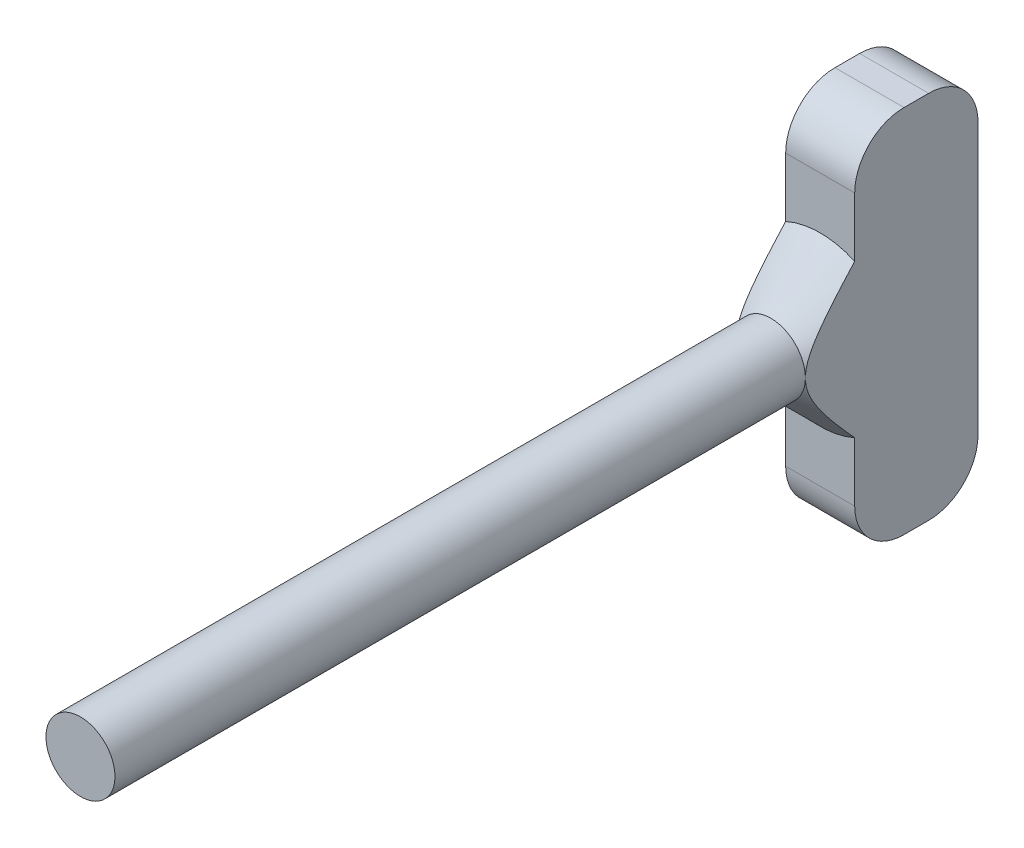
from build123d import *

# Parameters (mm, degrees)
SKETCH1_R           = 1.778
BOSS_EXTRUDE1_DEPTH = 38.1
SKETCH2_W           = 3.556
SKETCH2_H           = 19.05
BOSS_EXTRUDE2_DEPTH = 6.35
FILLET2_R           = 2.54
CHAMFER2_SIZE       = 2.54
BOSS_EXTRUDE3_DEPTH = 0.254


with BuildPart() as part:
    # Sketch1 → Boss-Extrude1 (new body)
    with BuildSketch(Plane.XY):
        with Locations(Location((0, 0, 0), (0, 0, 180))):
            Circle(SKETCH1_R)
    extrude(amount=BOSS_EXTRUDE1_DEPTH)

    # Sketch2 → Boss-Extrude2 (add)
    with BuildSketch(Plane(origin=(0, 0, 0), x_dir=(-1, 0, 0), z_dir=(0, 0, -1))):
        Rectangle(SKETCH2_W, SKETCH2_H)
    extrude(amount=BOSS_EXTRUDE2_DEPTH)

    # Fillet2
    fillet2_edges = [part.edges().sort_by_distance(p)[0] for p in [
        (0, 9.525, 0),
        (0, -9.525, 0),
        (0, 9.525, -6.35),
        (0, -9.525, -6.35),
    ]]
    fillet(fillet2_edges, radius=FILLET2_R)

    # Chamfer2
    # the kernel refuses this chamfer: 2.54 mm, written as the material it adds along each edge
    with BuildSketch(Plane(origin=(0, 0, 0), x_dir=(1, 0, 0), z_dir=(0, -1, 0))) as chamfer2_piece_1_section:
        Polygon((1.778, CHAMFER2_SIZE), (1.778 + CHAMFER2_SIZE, 0), (1.778, 0), align=None)
    chamfer2_piece_1 = revolve(axis=Axis((0, 0, 0), (0, 0, 1)), revolution_arc=180, mode=Mode.PRIVATE)
    chamfer2_piece_1 = split(chamfer2_piece_1, bisect_by=Plane(origin=(1.778, 2.298767146, 0.868261235), z_dir=(-1, 0, 0)), keep=Keep.TOP, mode=Mode.PRIVATE)
    chamfer2_piece_1 = split(chamfer2_piece_1, bisect_by=Plane(origin=(-1.778, 2.298767146, 0.868261235), z_dir=(1, 0, 0)), keep=Keep.TOP, mode=Mode.PRIVATE)
    add(chamfer2_piece_1)
    with BuildSketch(Plane(origin=(0, 0, 0), x_dir=(-1, 0, 0), z_dir=(0, 1, 0))) as chamfer2_piece_2_section:
        Polygon((1.778 + CHAMFER2_SIZE, 0), (1.778, CHAMFER2_SIZE), (1.778, 0), align=None)
    chamfer2_piece_2 = revolve(axis=Axis((0, 0, 0), (0, 0, 1)), revolution_arc=180, mode=Mode.PRIVATE)
    chamfer2_piece_2 = split(chamfer2_piece_2, bisect_by=Plane(origin=(1.778, -2.298767146, 0.868261235), z_dir=(-1, 0, 0)), keep=Keep.TOP, mode=Mode.PRIVATE)
    chamfer2_piece_2 = split(chamfer2_piece_2, bisect_by=Plane(origin=(-1.778, -2.298767146, 0.868261235), z_dir=(1, 0, 0)), keep=Keep.TOP, mode=Mode.PRIVATE)
    add(chamfer2_piece_2)

    # Sketch3 → Boss-Extrude3 (add)
    # profile 1 of 7: a face of its own
    with BuildSketch(Plane.ZY.offset(1.778)):
        with BuildLine():
            Line((-4.28625, 5.937860577), (-4.28625, 6.1515625))
            Line((-4.28625, 6.1515625), (-2.859503456, 6.1515625))
            add(Edge.make_bspline(
                [(-2.859503456, 6.1515625), (-2.839309955, 6.151530697), (-2.800989308, 6.151470346), (-2.746446232, 6.151873468), (-2.697955505, 6.153002431), (-2.655330213, 6.153714193), (-2.618765951, 6.155297611), (-2.588064624, 6.156588961), (-2.563371604, 6.158249411), (-2.54896101, 6.160244978), (-2.542766677, 6.161102764)],
                knots=[0, 0, 0, 0, 1.528628734, 2.90083645, 4.128790002, 5.200304208, 6.127813768, 6.898992206, 7.526736466, 8, 8, 8, 8], degree=3))
            add(Edge.make_bspline(
                [(-2.542766677, 6.161102764), (-2.520247803, 6.164585161), (-2.47677613, 6.171307771), (-2.414916243, 6.189168491), (-2.359062379, 6.212979709), (-2.307954675, 6.242518948), (-2.261917924, 6.279841904), (-2.220598789, 6.326179507), (-2.183050197, 6.380700986), (-2.150313224, 6.442625207), (-2.123122409, 6.508605574), (-2.1027767, 6.57627669), (-2.09032514, 6.644332505), (-2.088887153, 6.689901415), (-2.088173077, 6.712530048)],
                knots=[0, 0, 0, 0, 1.042777144, 2.01303441, 2.939567723, 3.817555404, 4.708046775, 5.641195415, 6.651191522, 7.732783915, 8.843021186, 9.914367358, 10.964315445, 12, 12, 12, 12], degree=3))
            add(Edge.make_bspline(
                [(-2.088173077, 6.712530048), (-2.088899629, 6.731958497), (-2.090348536, 6.770703182), (-2.099431362, 6.828240334), (-2.115478105, 6.884455311), (-2.137336698, 6.938906493), (-2.164216907, 6.990708957), (-2.196418961, 7.038534553), (-2.233928117, 7.081394052), (-2.275498615, 7.120505734), (-2.322343759, 7.154363828), (-2.373333404, 7.184299676), (-2.429827168, 7.208074244), (-2.469505718, 7.220111235), (-2.489818209, 7.226273287)],
                knots=[0, 0, 0, 0, 0.994718802, 1.98369237, 2.973235266, 3.981451368, 4.982709966, 5.955777334, 6.925228988, 7.892833478, 8.871333226, 9.877970804, 10.913677552, 12, 12, 12, 12], degree=3))
            add(Edge.make_bspline(
                [(-2.489818209, 7.226273287), (-2.49821965, 7.228314444), (-2.516941446, 7.232862964), (-2.548592538, 7.237113185), (-2.585936909, 7.241539946), (-2.629242874, 7.244611466), (-2.678365322, 7.247605868), (-2.733560151, 7.249397298), (-2.79462694, 7.250225315), (-2.83724258, 7.250472067), (-2.859503456, 7.250600962)],
                knots=[0, 0, 0, 0, 0.558680831, 1.244966039, 2.062412453, 2.990489873, 4.051219941, 5.244515665, 6.560634259, 8, 8, 8, 8], degree=3))
            Line((-2.859503456, 7.250600962), (-4.28625, 7.250600962))
            Line((-4.28625, 7.250600962), (-4.28625, 7.464302885))
            Line((-4.28625, 7.464302885), (-2.848055138, 7.464302885))
            add(Edge.make_bspline(
                [(-2.848055138, 7.464302885), (-2.822134639, 7.464129967), (-2.771549209, 7.463792509), (-2.697423302, 7.460866923), (-2.627106615, 7.456200506), (-2.560588255, 7.449613294), (-2.498111198, 7.440865316), (-2.439263921, 7.431227039), (-2.384370871, 7.418738211), (-2.332798724, 7.404258768), (-2.283458787, 7.387942414), (-2.23672446, 7.366438495), (-2.191223152, 7.342315957), (-2.147464355, 7.313937062), (-2.105726088, 7.281288378), (-2.064927907, 7.245620715), (-2.026285709, 7.20567689), (-1.989322903, 7.162636719), (-1.954947484, 7.116789584), (-1.925033077, 7.067839449), (-1.900674638, 7.016056565), (-1.879056044, 6.962667111), (-1.863690097, 6.906391045), (-1.852006666, 6.847929364), (-1.845423895, 6.786935303), (-1.844440357, 6.745458581), (-1.843942308, 6.724455379)],
                knots=[0, 0, 0, 0, 1.316707045, 2.569633854, 3.76780728, 4.896239288, 5.964314126, 6.972204208, 7.924543903, 8.822147865, 9.693191779, 10.560896119, 11.431827672, 12.307838457, 13.206132673, 14.12176355, 15.058527151, 16.026630406, 17.00238624, 17.966538933, 18.934743273, 19.906713913, 20.888635248, 21.892958714, 22.933025263, 24, 24, 24, 24], degree=3))
            add(Edge.make_bspline(
                [(-1.843942308, 6.724455379), (-1.844475858, 6.701548197), (-1.845522683, 6.656604388), (-1.851530544, 6.590382109), (-1.862817891, 6.526886493), (-1.877283175, 6.465497841), (-1.89690774, 6.406809235), (-1.921021095, 6.350837971), (-1.948550153, 6.296941382), (-1.981080076, 6.246333744), (-2.016551767, 6.198599908), (-2.055513531, 6.155220765), (-2.096481503, 6.115095132), (-2.140998334, 6.079991657), (-2.188152724, 6.048582611), (-2.238166461, 6.021560107), (-2.2909725, 5.998348721), (-2.327680236, 5.986370265), (-2.34623723, 5.980314754)],
                knots=[0, 0, 0, 0, 1.138939089, 2.234594419, 3.301501784, 4.342532435, 5.367382236, 6.373123747, 7.370098489, 8.372230273, 9.360297234, 10.323289009, 11.268038109, 12.20748145, 13.137029304, 14.081414587, 15.030090602, 16, 16, 16, 16], degree=3))
            add(Edge.make_bspline(
                [(-2.34623723, 5.980314754), (-2.358914035, 5.976792437), (-2.386410307, 5.969152454), (-2.431917008, 5.960970957), (-2.484314657, 5.954093171), (-2.543606842, 5.947625997), (-2.609839519, 5.943809902), (-2.682983978, 5.940464287), (-2.763128662, 5.937837007), (-2.818955038, 5.937852501), (-2.848055138, 5.937860577)],
                knots=[0, 0, 0, 0, 0.625038921, 1.35572334, 2.194682327, 3.136881307, 4.189498639, 5.346923369, 6.617055217, 8, 8, 8, 8], degree=3))
            Line((-2.848055138, 5.937860577), (-4.28625, 5.937860577))
        make_face()
    # profile 2 of 7: a face of its own
    with BuildSketch(Plane.ZY.offset(1.778)):
        Polygon((-4.28625, 4.350360577), (-4.28625, 5.510456731), (-4.042019231, 5.510456731), (-4.042019231, 4.5640625), (-3.309326923, 4.5640625), (-3.309326923, 5.510456731), (-3.065096154, 5.510456731), (-3.065096154, 4.5640625), (-1.905, 4.5640625), (-1.905, 4.350360577), align=None)
    # profile 3 of 7: a face of its own
    with BuildSketch(Plane.ZY.offset(1.778)):
        Polygon((-1.905, 1.205889423), (-4.28625, 1.520241136), (-4.28625, 1.550769982), (-2.332403846, 2.533894231), (-4.28625, 3.5141564), (-4.28625, 3.544685246), (-1.905, 3.861899038), (-1.905, 3.648197115), (-3.617000451, 3.419230769), (-1.905, 2.560129958), (-1.905, 2.511474609), (-3.622247596, 1.648557692), (-1.905, 1.421022386), align=None)
    # profile 4 of 7: a face of its own
    with BuildSketch(Plane.ZY.offset(1.778)):
        Polygon((-4.28625, -0.1984375), (-4.28625, 0.015264423), (-2.149230769, 0.015264423), (-2.149230769, 0.931129808), (-1.905, 0.931129808), (-1.905, -0.1984375), align=None)
    # profile 5 of 7: a face of its own
    with BuildSketch(Plane.ZY.offset(1.778)):
        with BuildLine():
            Line((-1.905, -2.640745192), (-4.28625, -2.640745192))
            Line((-4.28625, -2.640745192), (-4.28625, -2.159915865))
            add(Edge.make_bspline(
                [(-4.28625, -2.159915865), (-4.285948894, -2.118095), (-4.28536716, -2.037297306), (-4.281678678, -1.920539552), (-4.275153736, -1.812509885), (-4.265649469, -1.7135636), (-4.25397928, -1.623429062), (-4.239351326, -1.542358651), (-4.222078303, -1.469933176), (-4.207351666, -1.425390574), (-4.20038762, -1.404326923)],
                knots=[0, 0, 0, 0, 1.314313732, 2.53924729, 3.670748893, 4.714932338, 5.66265055, 6.526160246, 7.303039223, 8, 8, 8, 8], degree=3))
            add(Edge.make_bspline(
                [(-4.20038762, -1.404326923), (-4.189892499, -1.376773557), (-4.16914025, -1.322291643), (-4.129933948, -1.244762103), (-4.085693964, -1.171527989), (-4.035402211, -1.103173187), (-3.979715418, -1.039526188), (-3.919031408, -0.979864617), (-3.852002114, -0.925659431), (-3.779820616, -0.876066384), (-3.703411764, -0.831339749), (-3.622900694, -0.792465501), (-3.538701847, -0.760179624), (-3.451047865, -0.733378219), (-3.35974642, -0.712255524), (-3.264691087, -0.69784425), (-3.166257569, -0.688338986), (-3.099463871, -0.687383729), (-3.065573167, -0.686899038)],
                knots=[0, 0, 0, 0, 0.984741985, 1.947153288, 2.898543998, 3.841229145, 4.778974371, 5.722123648, 6.681464302, 7.655713756, 8.646344578, 9.637374342, 10.639946623, 11.656849581, 12.698333139, 13.76849723, 14.867749466, 16, 16, 16, 16], degree=3))
            add(Edge.make_bspline(
                [(-3.065573167, -0.686899038), (-3.036140075, -0.687326961), (-2.978139092, -0.688170228), (-2.892658407, -0.695742133), (-2.809713652, -0.706747825), (-2.729699723, -0.723786761), (-2.651915889, -0.744471556), (-2.577190059, -0.770980259), (-2.504840775, -0.801351404), (-2.435831526, -0.836752633), (-2.370493737, -0.875670152), (-2.308855034, -0.917174519), (-2.2522832, -0.962207021), (-2.199295797, -1.009434831), (-2.151308324, -1.059996842), (-2.107446034, -1.113277469), (-2.068443277, -1.169483774), (-2.033687161, -1.228963691), (-2.002605729, -1.292511589), (-1.976680085, -1.36212637), (-1.95422583, -1.437478284), (-1.93636347, -1.518997044), (-1.921957348, -1.606391897), (-1.912365697, -1.699905279), (-1.905860745, -1.799360461), (-1.905292486, -1.867654447), (-1.905, -1.902805739)],
                knots=[0, 0, 0, 0, 1.106010661, 2.179509527, 3.223302912, 4.248870533, 5.252098245, 6.246278179, 7.226402005, 8.199283979, 9.158616973, 10.083547221, 10.989831858, 11.874256832, 12.749262829, 13.607058236, 14.46581075, 15.317568432, 16.194266721, 17.121067875, 18.106207572, 19.147242834, 20.255495536, 21.43354536, 22.679031616, 24, 24, 24, 24], degree=3))
            Line((-1.905, -1.902805739), (-1.905, -2.640745192))
        make_face()
        with BuildLine():
            Line((-2.149230769, -2.427043269), (-2.149230769, -2.153714694))
            add(Edge.make_bspline(
                [(-2.149230769, -2.153714694), (-2.149399563, -2.114438784), (-2.149724216, -2.038896827), (-2.15257301, -1.930272368), (-2.157227971, -1.831022278), (-2.163742444, -1.741132466), (-2.172361626, -1.660653683), (-2.181971605, -1.589417739), (-2.193944156, -1.527658144), (-2.204796505, -1.490286509), (-2.209811448, -1.473016827)],
                knots=[0, 0, 0, 0, 1.375205317, 2.645023457, 3.804390687, 4.853969522, 5.800190428, 6.637939096, 7.370582563, 8, 8, 8, 8], degree=3))
            add(Edge.make_bspline(
                [(-2.209811448, -1.473016827), (-2.217466525, -1.451280528), (-2.232593837, -1.408327102), (-2.260187552, -1.346495539), (-2.292873241, -1.288830385), (-2.329206138, -1.234327398), (-2.37046604, -1.183757083), (-2.415761989, -1.136530063), (-2.465300931, -1.092704156), (-2.519002536, -1.052954401), (-2.576284477, -1.01695027), (-2.637248059, -0.986042235), (-2.701036228, -0.959125385), (-2.768165384, -0.937812114), (-2.838143506, -0.921007534), (-2.911333462, -0.909228463), (-2.987670487, -0.901915838), (-3.039638751, -0.901044032), (-3.06605018, -0.900600962)],
                knots=[0, 0, 0, 0, 0.998590647, 1.973329978, 2.929871262, 3.868367705, 4.809062953, 5.754642869, 6.701828697, 7.672172887, 8.647399344, 9.630604387, 10.631475358, 11.644913558, 12.679592956, 13.747988925, 14.855477812, 16, 16, 16, 16], degree=3))
            add(Edge.make_bspline(
                [(-3.06605018, -0.900600962), (-3.093899566, -0.90095018), (-3.148609931, -0.901636224), (-3.228885743, -0.910259281), (-3.306093114, -0.922860554), (-3.380237208, -0.941083026), (-3.451462676, -0.964304213), (-3.519375593, -0.993283782), (-3.584693191, -1.026394464), (-3.645907893, -1.065789413), (-3.703801598, -1.108934665), (-3.756838782, -1.156816758), (-3.805140261, -1.208674966), (-3.849458258, -1.263943676), (-3.888009794, -1.324180524), (-3.92249484, -1.387966517), (-3.951761009, -1.456237411), (-3.967326806, -1.503734977), (-3.97523738, -1.527873347)],
                knots=[0, 0, 0, 0, 1.122418816, 2.205001699, 3.251619955, 4.274784885, 5.280384055, 6.268708349, 7.249350384, 8.229342522, 9.199999885, 10.157847722, 11.105861043, 12.055065948, 13.010012805, 13.98527497, 14.976112212, 16, 16, 16, 16], degree=3))
            add(Edge.make_bspline(
                [(-3.97523738, -1.527873347), (-3.980759449, -1.547842609), (-3.992500885, -1.59030274), (-4.005308861, -1.659589946), (-4.016605851, -1.737569182), (-4.026170338, -1.824586657), (-4.033033319, -1.92054318), (-4.038184517, -2.02551255), (-4.041658851, -2.139540138), (-4.041896097, -2.218585755), (-4.042019231, -2.259611629)],
                knots=[0, 0, 0, 0, 0.674548936, 1.434276114, 2.292660221, 3.240891867, 4.284742987, 5.42552168, 6.663806718, 8, 8, 8, 8], degree=3))
            Line((-4.042019231, -2.259611629), (-4.042019231, -2.427043269))
            Line((-4.042019231, -2.427043269), (-2.149230769, -2.427043269))
        make_face(mode=Mode.SUBTRACT)
    # profile 6 of 7: a face of its own
    with BuildSketch(Plane.ZY.offset(1.778)):
        with BuildLine():
            Line((-3.879834736, -3.281850962), (-3.706201923, -3.465024038))
            add(Edge.make_bspline(
                [(-3.706201923, -3.465024038), (-3.737393728, -3.498163609), (-3.799033551, -3.563652519), (-3.878882129, -3.670604623), (-3.947960782, -3.781744944), (-4.003747067, -3.89725319), (-4.047508769, -4.014100447), (-4.079319523, -4.130277521), (-4.099465007, -4.245032203), (-4.101884642, -4.321343987), (-4.103076923, -4.358946815)],
                knots=[0, 0, 0, 0, 1.089067066, 2.152164705, 3.18986567, 4.218445106, 5.218487318, 6.173592265, 7.100032889, 8, 8, 8, 8], degree=3))
            add(Edge.make_bspline(
                [(-4.103076923, -4.358946815), (-4.102795523, -4.382020923), (-4.102233454, -4.428109296), (-4.095059622, -4.496568155), (-4.084742098, -4.564309027), (-4.069813785, -4.631204037), (-4.050893693, -4.697383253), (-4.027227152, -4.7626165), (-3.999635111, -4.827025483), (-3.967751861, -4.890003435), (-3.932727295, -4.951059184), (-3.893913491, -5.008723531), (-3.852556944, -5.06336741), (-3.807613044, -5.113951424), (-3.759522474, -5.160812052), (-3.709151303, -5.204811225), (-3.655509176, -5.245128902), (-3.598816681, -5.28104199), (-3.540392744, -5.313472978), (-3.480732857, -5.341498385), (-3.420390858, -5.365861943), (-3.358912382, -5.384417977), (-3.296931246, -5.400134822), (-3.23412264, -5.411075806), (-3.170322546, -5.41726455), (-3.127597684, -5.418333045), (-3.106119291, -5.418870192)],
                knots=[0, 0, 0, 0, 1.028150113, 2.053633673, 3.06513288, 4.081487945, 5.106702018, 6.131327874, 7.172780699, 8.228344599, 9.276313556, 10.308389736, 11.324843658, 12.329040066, 13.321460474, 14.316307835, 15.308626991, 16.309440696, 17.305625405, 18.28535951, 19.246194545, 20.203493668, 21.145557131, 22.095268976, 23.042464743, 24, 24, 24, 24], degree=3))
            add(Edge.make_bspline(
                [(-3.106119291, -5.418870192), (-3.084163716, -5.418355709), (-3.04031252, -5.417328149), (-2.97486461, -5.410760527), (-2.910396293, -5.398544572), (-2.846806166, -5.382344078), (-2.783967676, -5.361747847), (-2.721946398, -5.336443654), (-2.660748363, -5.30629966), (-2.600981085, -5.271484922), (-2.542810459, -5.233038302), (-2.487556969, -5.1907533), (-2.435863625, -5.144558726), (-2.386975377, -5.095301588), (-2.341200759, -5.042533091), (-2.299091515, -4.985741277), (-2.259996507, -4.925721128), (-2.224345224, -4.862446016), (-2.192499497, -4.796584737), (-2.164180169, -4.729054915), (-2.140858034, -4.659639503), (-2.12185013, -4.588703653), (-2.106269753, -4.516331834), (-2.096246404, -4.442156712), (-2.088972821, -4.366723673), (-2.088441006, -4.31587471), (-2.088173077, -4.290256911)],
                knots=[0, 0, 0, 0, 0.935915162, 1.869274651, 2.799799983, 3.730201895, 4.664668062, 5.616159355, 6.583070886, 7.570012957, 8.562524459, 9.553461134, 10.53281078, 11.515274572, 12.509912756, 13.507571325, 14.526460018, 15.561318395, 16.601025881, 17.643204557, 18.680545676, 19.719612342, 20.772381578, 21.833430283, 22.908478249, 24, 24, 24, 24], degree=3))
            add(Edge.make_bspline(
                [(-2.088173077, -4.290256911), (-2.08881818, -4.259383303), (-2.090084945, -4.198757957), (-2.099954118, -4.109642179), (-2.115348198, -4.024044665), (-2.137962624, -3.942244076), (-2.166586915, -3.863943545), (-2.201984931, -3.789431859), (-2.243784227, -3.71850327), (-2.291138372, -3.651464782), (-2.343899025, -3.589910136), (-2.400324246, -3.533888115), (-2.461145066, -3.485325159), (-2.525455043, -3.442770645), (-2.593869313, -3.407598056), (-2.666007283, -3.3787197), (-2.741913589, -3.356586011), (-2.794363356, -3.347499781), (-2.820865385, -3.342908654)],
                knots=[0, 0, 0, 0, 1.130199668, 2.219330667, 3.279027493, 4.311506524, 5.322739849, 6.327972234, 7.327472899, 8.33386792, 9.329086447, 10.29244429, 11.240784345, 12.174119183, 13.111530729, 14.052100829, 15.015757696, 16, 16, 16, 16], degree=3))
            Line((-2.820865385, -3.342908654), (-2.820865385, -4.136658654))
            Line((-2.820865385, -4.136658654), (-3.065096154, -4.136658654))
            Line((-3.065096154, -4.136658654), (-3.065096154, -3.129206731))
            add(Edge.make_bspline(
                [(-3.065096154, -3.129206731), (-3.019575166, -3.130367317), (-2.93048237, -3.132638794), (-2.800554382, -3.14857202), (-2.677837212, -3.174300754), (-2.562201622, -3.209448217), (-2.453811481, -3.254947291), (-2.35255674, -3.310309672), (-2.259091534, -3.376421419), (-2.172652837, -3.45092763), (-2.095548498, -3.534543494), (-2.027780887, -3.625009644), (-1.970697143, -3.722475546), (-1.924255514, -3.826849004), (-1.888010171, -3.937788335), (-1.862312009, -4.055550251), (-1.846915552, -4.179975054), (-1.844948381, -4.265248757), (-1.843942308, -4.308860427)],
                knots=[0, 0, 0, 0, 1.140356446, 2.231883559, 3.274166699, 4.278491846, 5.25512956, 6.21435461, 7.1637429, 8.11826594, 9.068280886, 10.0076534, 10.945064095, 11.891975133, 12.864533718, 13.863980011, 14.907571808, 16, 16, 16, 16], degree=3))
            add(Edge.make_bspline(
                [(-1.843942308, -4.308860427), (-1.844329513, -4.335741429), (-1.845093208, -4.388759431), (-1.850520653, -4.467062366), (-1.858875831, -4.543206318), (-1.871493138, -4.617180196), (-1.886947215, -4.689256103), (-1.906736572, -4.759074071), (-1.929643312, -4.82690006), (-1.955698047, -4.892838904), (-1.985886621, -4.956292104), (-2.019434786, -5.017542288), (-2.056169555, -5.076928027), (-2.09672622, -5.134044802), (-2.140801429, -5.189190212), (-2.188483524, -5.24200868), (-2.239626732, -5.292795897), (-2.275943523, -5.324609713), (-2.294242788, -5.340640024)],
                knots=[0, 0, 0, 0, 1.107784379, 2.184907829, 3.233506516, 4.263428166, 5.276301166, 6.270063455, 7.25232949, 8.225834625, 9.190232166, 10.146266622, 11.1027726, 12.066435141, 13.031522626, 14.010570082, 14.99756817, 16, 16, 16, 16], degree=3))
            add(Edge.make_bspline(
                [(-2.294242788, -5.340640024), (-2.323274072, -5.363898667), (-2.38085475, -5.410029883), (-2.473111141, -5.469410201), (-2.568634549, -5.520029727), (-2.667690894, -5.561101406), (-2.770187523, -5.593172139), (-2.875993462, -5.616172465), (-2.985244961, -5.629648496), (-3.05917615, -5.63158992), (-3.096579026, -5.632572115)],
                knots=[0, 0, 0, 0, 1.023165419, 2.029347347, 3.013907458, 3.994755782, 4.975994455, 5.96558838, 6.970761222, 8, 8, 8, 8], degree=3))
            add(Edge.make_bspline(
                [(-3.096579026, -5.632572115), (-3.124586781, -5.632210003), (-3.180246327, -5.631490382), (-3.262880673, -5.622764449), (-3.344047755, -5.610244917), (-3.423681202, -5.591843246), (-3.501834281, -5.568645662), (-3.578542969, -5.539693893), (-3.653853711, -5.50598643), (-3.727243691, -5.466804855), (-3.797755643, -5.423215232), (-3.865044508, -5.375857166), (-3.928019738, -5.32436523), (-3.986827217, -5.268589487), (-4.042338546, -5.209654277), (-4.093394178, -5.146322348), (-4.140793052, -5.07955323), (-4.183624399, -5.008829329), (-4.222110742, -4.935266645), (-4.255848346, -4.859025084), (-4.283731845, -4.780132355), (-4.307390378, -4.69917832), (-4.324885873, -4.615550535), (-4.337573676, -4.529855782), (-4.346255442, -4.441647403), (-4.346953663, -4.382023605), (-4.347307692, -4.351791617)],
                knots=[0, 0, 0, 0, 1.00895651, 2.005089799, 2.991467152, 3.967318338, 4.948153826, 5.927364234, 6.919980553, 7.91976625, 8.923240147, 9.905815003, 10.88314567, 11.851989312, 12.825009789, 13.798721852, 14.781296708, 15.773896486, 16.776076962, 17.771600213, 18.775744723, 19.78957137, 20.808953803, 21.851964491, 22.910847925, 24, 24, 24, 24], degree=3))
            add(Edge.make_bspline(
                [(-4.347307692, -4.351791617), (-4.346913431, -4.327136669), (-4.346131657, -4.278248804), (-4.340712852, -4.205501118), (-4.332124104, -4.133877871), (-4.320403737, -4.063272863), (-4.304440047, -3.993926532), (-4.285336786, -3.925641327), (-4.263094671, -3.858318262), (-4.236568331, -3.792168328), (-4.206460061, -3.726746739), (-4.172569143, -3.661689737), (-4.13431606, -3.597219607), (-4.091587226, -3.533224546), (-4.045116508, -3.469301007), (-3.993574811, -3.406460063), (-3.938994686, -3.343184846), (-3.899750201, -3.302498254), (-3.879834736, -3.281850962)],
                knots=[0, 0, 0, 0, 0.985871117, 1.954866573, 2.915460327, 3.869826059, 4.81536089, 5.759505086, 6.70452669, 7.649098992, 8.607881297, 9.583363685, 10.581137262, 11.603961102, 12.659522466, 13.73993555, 14.853081303, 16, 16, 16, 16], degree=3))
        make_face()
    # profile 7 of 7: a face of its own
    with BuildSketch(Plane.ZY.offset(1.778)):
        with BuildLine():
            Line((-4.28625, -7.464302885), (-4.28625, -6.997306941))
            add(Edge.make_bspline(
                [(-4.28625, -6.997306941), (-4.286214692, -6.965186664), (-4.28614704, -6.903642786), (-4.284095937, -6.815390222), (-4.281356348, -6.735237529), (-4.277558667, -6.663357538), (-4.27307063, -6.599529085), (-4.266775939, -6.544040994), (-4.260203487, -6.496457117), (-4.253521423, -6.467945765), (-4.250474008, -6.454942909)],
                knots=[0, 0, 0, 0, 1.415646017, 2.712440637, 3.8905458, 4.950247383, 5.884950622, 6.709939814, 7.411656543, 8, 8, 8, 8], degree=3))
            add(Edge.make_bspline(
                [(-4.250474008, -6.454942909), (-4.245968541, -6.438482809), (-4.237063773, -6.40595047), (-4.219231629, -6.359071076), (-4.198075187, -6.314478761), (-4.174009262, -6.271974496), (-4.145849216, -6.23233243), (-4.115468419, -6.194231071), (-4.080903535, -6.159015397), (-4.043244749, -6.126208415), (-4.002969693, -6.095885831), (-3.959346621, -6.070409378), (-3.913677917, -6.04813356), (-3.865342906, -6.029895219), (-3.814294663, -6.01633243), (-3.760895967, -6.006263425), (-3.705086774, -5.999843057), (-3.666945529, -5.999230234), (-3.647529297, -5.998918269)],
                knots=[0, 0, 0, 0, 0.999549623, 1.97554611, 2.93413192, 3.889860808, 4.833293765, 5.780583482, 6.742559327, 7.719844669, 8.705620613, 9.691528643, 10.674968152, 11.680406189, 12.713313868, 13.765869198, 14.862690416, 16, 16, 16, 16], degree=3))
            add(Edge.make_bspline(
                [(-3.647529297, -5.998918269), (-3.627950131, -5.999204989), (-3.58964217, -5.999765974), (-3.533599255, -6.006498983), (-3.480042636, -6.015568274), (-3.429091064, -6.02951359), (-3.38104712, -6.047778235), (-3.335176603, -6.069204078), (-3.292259898, -6.095046444), (-3.252141198, -6.124740516), (-3.214782847, -6.15777294), (-3.180455567, -6.194003957), (-3.149360294, -6.233287297), (-3.121427318, -6.275498116), (-3.097304385, -6.321047924), (-3.075698075, -6.369245889), (-3.057552229, -6.420510947), (-3.048006776, -6.455986479), (-3.043153546, -6.474023437)],
                knots=[0, 0, 0, 0, 1.121902311, 2.195077645, 3.232258892, 4.234102512, 5.217864754, 6.176164875, 7.132989551, 8.084763148, 9.034132444, 9.988522005, 10.94243251, 11.903244335, 12.886203696, 13.894208494, 14.929344452, 16, 16, 16, 16], degree=3))
            add(Edge.make_bspline(
                [(-3.043153546, -6.474023437), (-3.039983418, -6.488942026), (-3.033035897, -6.521636979), (-3.025227079, -6.575478919), (-3.018822995, -6.638198746), (-3.012846653, -6.709583059), (-3.009679939, -6.789798325), (-3.005961699, -6.878660568), (-3.004207265, -6.976470529), (-3.004096363, -7.044689927), (-3.004038462, -7.080307242)],
                knots=[0, 0, 0, 0, 0.601372724, 1.317943291, 2.144091499, 3.08771165, 4.142394186, 5.309582461, 6.595334295, 8, 8, 8, 8], degree=3))
            Line((-3.004038462, -7.080307242), (-3.004038462, -7.250600962))
            Line((-3.004038462, -7.250600962), (-1.905, -7.250600962))
            Line((-1.905, -7.250600962), (-1.905, -7.464302885))
            Line((-1.905, -7.464302885), (-4.28625, -7.464302885))
        make_face()
        with BuildLine():
            Line((-4.042019231, -7.250600962), (-3.248269231, -7.250600962))
            Line((-3.248269231, -7.250600962), (-3.243022085, -6.833691406))
            add(Edge.make_bspline(
                [(-3.243022085, -6.833691406), (-3.243010876, -6.813335029), (-3.242989237, -6.774037461), (-3.245709821, -6.717272935), (-3.248808576, -6.664600512), (-3.253495264, -6.616218264), (-3.25963877, -6.571956427), (-3.267278833, -6.532197314), (-3.275584798, -6.496346264), (-3.289462004, -6.455106576), (-3.310799632, -6.408751808), (-3.341861311, -6.358112762), (-3.382100231, -6.315529091), (-3.427216569, -6.278746833), (-3.477271468, -6.248983218), (-3.531108931, -6.227986175), (-3.58793136, -6.215057062), (-3.626790071, -6.21344234), (-3.64657527, -6.212620192)],
                knots=[0, 0, 0, 0, 1.160746174, 2.240796558, 3.240300023, 4.169675897, 5.012224395, 5.787635701, 6.478238024, 7.109103438, 8.265591281, 9.382545711, 10.479929969, 11.588830844, 12.694575677, 13.785760505, 14.872603606, 16, 16, 16, 16], degree=3))
            add(Edge.make_bspline(
                [(-3.64657527, -6.212620192), (-3.66571949, -6.213479251), (-3.70377583, -6.215186954), (-3.759550941, -6.227879479), (-3.812778109, -6.249208687), (-3.862429909, -6.278772854), (-3.907446972, -6.314662464), (-3.946619725, -6.356343271), (-3.97790011, -6.40392191), (-3.998867443, -6.447812078), (-4.011143076, -6.487115183), (-4.020009319, -6.521085286), (-4.026123205, -6.55963738), (-4.031973431, -6.602405161), (-4.036695731, -6.64933433), (-4.039975076, -6.700723158), (-4.041874165, -6.756400514), (-4.041969705, -6.79505181), (-4.042019231, -6.815087891)],
                knots=[0, 0, 0, 0, 1.120540835, 2.227496496, 3.330685923, 4.466139262, 5.598993257, 6.692710361, 7.80064471, 8.921224235, 9.527843361, 10.209888745, 10.975318552, 11.811557897, 12.738105936, 13.73658638, 14.826690375, 16, 16, 16, 16], degree=3))
            Line((-4.042019231, -6.815087891), (-4.042019231, -7.250600962))
        make_face(mode=Mode.SUBTRACT)
    extrude(amount=BOSS_EXTRUDE3_DEPTH)


solid = part.part
